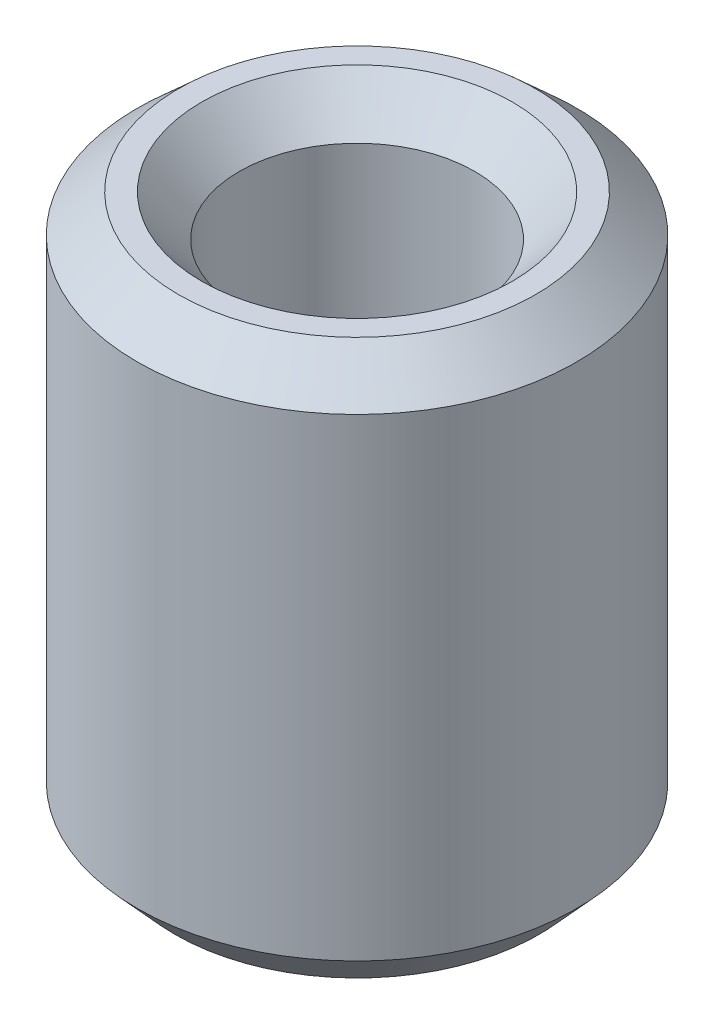
from build123d import *
from OCP.BRepFilletAPI import BRepFilletAPI_MakeChamfer

# Parameters (mm, degrees)
SKETCH1_R           = 15
BOSS_EXTRUDE1_DEPTH = 37.691881576
SKETCH2_R           = 8.034443932
CUT_EXTRUDE1_DEPTH  = 44.251334509
CHAMFER1_SIZE       = 2.566900968
CHAMFER1_SIZE2      = 2.819118689


with BuildPart() as part:
    # Sketch1 → Boss-Extrude1 (new body)
    with BuildSketch(Plane(origin=(0, 0, 0), x_dir=(1, 0, 0), z_dir=(0, 1, 0))):
        Circle(SKETCH1_R)
    extrude(amount=BOSS_EXTRUDE1_DEPTH)

    # Sketch2 → Cut-Extrude1 (cut, through all)
    with BuildSketch(Plane(origin=(0, 0, 0), x_dir=(1, 0, 0), z_dir=(0, 1, 0))):
        Circle(SKETCH2_R)
    extrude(amount=CUT_EXTRUDE1_DEPTH, mode=Mode.SUBTRACT)

    # Chamfer1: one chamfer whose edges measure the first distance from different faces: ONE call of the kernel's chamfer builder (chamfer() names one face for all edges)
    chamfer1_edges_1 = [part.edges().sort_by_distance(p)[0] for p in [
        (-8.034443932, 37.691881576, 0),
    ]]
    chamfer1_side_1 = [part.faces().sort_by_distance(p)[0] for p in [
        (-14.575735931, 37.691881576, 0),
    ]]
    chamfer1_edges_2 = [part.edges().sort_by_distance(p)[0] for p in [
        (-8.034443932, 0, 0),
    ]]
    chamfer1_side_2 = [part.faces().sort_by_distance(p)[0] for p in [
        (-8.034443932, 18.845940788, 0),
    ]]
    chamfer1_edges_3 = [part.edges().sort_by_distance(p)[0] for p in [
        (-15, 0, 0),
    ]]
    chamfer1_side_3 = [part.faces().sort_by_distance(p)[0] for p in [
        (-14.575735931, 0, 0),
    ]]
    chamfer1_edges_4 = [part.edges().sort_by_distance(p)[0] for p in [
        (-15, 37.691881576, 0),
    ]]
    chamfer1_side_4 = [part.faces().sort_by_distance(p)[0] for p in [
        (-15, 18.845940788, 0),
    ]]
    chamfer1 = BRepFilletAPI_MakeChamfer(part.part.solid().wrapped)
    for e in chamfer1_edges_1:
        chamfer1.Add(CHAMFER1_SIZE, CHAMFER1_SIZE2, e.wrapped, chamfer1_side_1[0].wrapped)  # the first distance lies on this face
    for e in chamfer1_edges_2:
        chamfer1.Add(CHAMFER1_SIZE, CHAMFER1_SIZE2, e.wrapped, chamfer1_side_2[0].wrapped)  # the first distance lies on this face
    for e in chamfer1_edges_3:
        chamfer1.Add(CHAMFER1_SIZE, CHAMFER1_SIZE2, e.wrapped, chamfer1_side_3[0].wrapped)  # the first distance lies on this face
    for e in chamfer1_edges_4:
        chamfer1.Add(CHAMFER1_SIZE, CHAMFER1_SIZE2, e.wrapped, chamfer1_side_4[0].wrapped)  # the first distance lies on this face
    add(Compound.cast(chamfer1.Shape()), mode=Mode.REPLACE)


solid = part.part
